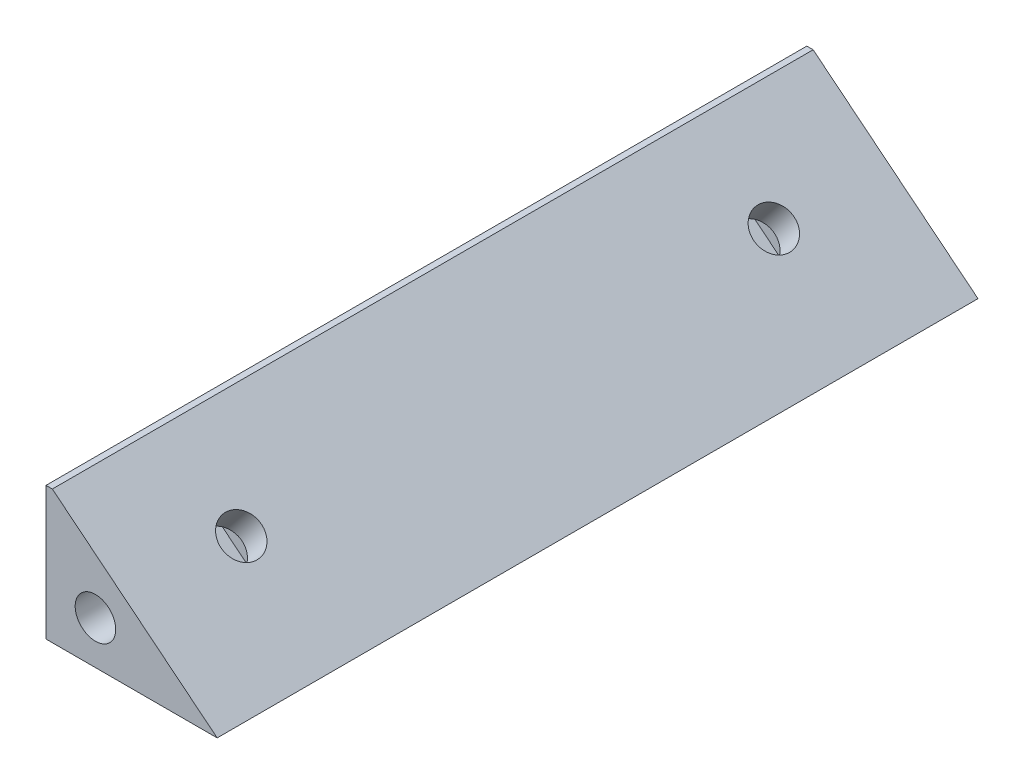
from build123d import *

# Parameters (mm, degrees)
BOSS_EXTRUDE1_DEPTH     = 30
SKETCH1_13_W            = 0.5
SKETCH1_13_H            = 10.5
BOSS_EXTRUDE6_DEPTH     = 30
CUT_EXTRUDE3_DEPTH      = 5
BOSS_EXTRUDE4_START     = -2.45
BOSS_EXTRUDE4_OUTLINE_R = 1.6
BOSS_EXTRUDE4_DEPTH     = 2.45
CUT_EXTRUDE1_DEPTH      = 5
SKETCH1_10_R            = 1.6
BOSS_EXTRUDE5_DEPTH     = 2.45
CUT_EXTRUDE4_DEPTH      = 63.283625457


# Read off the part's stored shape, not the designer's step: Boss-Extrude4
with BuildPart() as part:
    # Sketch1 → Boss-Extrude1 (new body)
    with BuildSketch(Plane.XY):
        Polygon((13, 0), (0, 10.5), (0, 0), align=None)
    boss_extrude1 = extrude(amount=BOSS_EXTRUDE1_DEPTH)

    # Sketch1<13> → Boss-Extrude6 (add)
    with BuildSketch(Plane.XY):
        with Locations((-0.25, 5.25)):
            Rectangle(SKETCH1_13_W, SKETCH1_13_H)
    boss_extrude6 = extrude(amount=BOSS_EXTRUDE6_DEPTH)

    # Sketch4 → Cut-Extrude3 (cut)
    with BuildSketch(Plane(origin=(5.132497762, 6.354521038, 0), x_dir=(0, 0, -1), z_dir=(0.6283371070876215, 0.7779411802037215, 0))):
        Polygon((-11.825, -10.113235343), (-6.175, -10.113235343), (-6.175, 0.645733136), (-9, 2.276747647), (-11.825, 0.645733136), align=None)
    cut_extrude3 = extrude(amount=-CUT_EXTRUDE3_DEPTH, mode=Mode.SUBTRACT)

    # Boss-Extrude4 outline → Boss-Extrude4 (add)
    with BuildSketch(Plane(origin=(5.132497762, 6.354521038, 0), x_dir=(0, 0, -1), z_dir=(0.6283371070876215, 0.7779411802037215, 0)).offset(BOSS_EXTRUDE4_START)):
        Polygon((-6.175, -0.985281374), (0, -0.985281374), (0, 3.886764657), (-30, 3.886764657), (-30, -10.113235343), (0, -10.113235343), (0, -8.485281374), (-6.175, -8.485281374), align=None)
        with Locations((-9, -0.985281374)):
            Circle(BOSS_EXTRUDE4_OUTLINE_R, mode=Mode.SUBTRACT)
    boss_extrude4 = extrude(amount=BOSS_EXTRUDE4_DEPTH)

    # Sketch1<4> → Cut-Extrude1 (cut)
    with BuildSketch(Plane.XY):
        Polygon((9.15, 0), (9.15, 2.387149176), (3.906218974, 6.622510773), (0.862333294, 5.449653878), (0.356114319, 2.227143105), (3.113529592, 0), align=None)
    cut_extrude1 = extrude(amount=CUT_EXTRUDE1_DEPTH, mode=Mode.SUBTRACT)

    # Sketch1<10> → Boss-Extrude5 (add)
    with BuildSketch(Plane.XY):
        Polygon((3.113529592, 0), (9.15, 0), (9.15, 2.387149176), (3.906218974, 6.622510773), (0.862333294, 5.449653878), (0.356114319, 2.227143105), align=None)
        with Locations((3.4, 3.4)):
            Circle(SKETCH1_10_R, mode=Mode.SUBTRACT)
    boss_extrude5 = extrude(amount=BOSS_EXTRUDE5_DEPTH)

    # Mirror1: Boss-Extrude1, Boss-Extrude6, Cut-Extrude3, Boss-Extrude4, Cut-Extrude1, Boss-Extrude5 across plane
    add(boss_extrude1.mirror(Plane.XY.offset(30)))
    add(boss_extrude6.mirror(Plane.XY.offset(30)))
    add(cut_extrude3.mirror(Plane.XY.offset(30)), mode=Mode.SUBTRACT)
    add(boss_extrude4.mirror(Plane.XY.offset(30)))
    add(cut_extrude1.mirror(Plane.XY.offset(30)), mode=Mode.SUBTRACT)
    add(boss_extrude5.mirror(Plane.XY.offset(30)))

    # Sketch1<12> → Cut-Extrude4 (cut, through all)
    with BuildSketch(Plane.XY):
        Polygon((13, -3.5), (13, 0), (12.105518027, 0), (9.15, 0), (3.4, 0), (3.113529592, 0), (0, 0), (0, -3.5), align=None)
    extrude(amount=CUT_EXTRUDE4_DEPTH, mode=Mode.SUBTRACT)


solid = part.part
